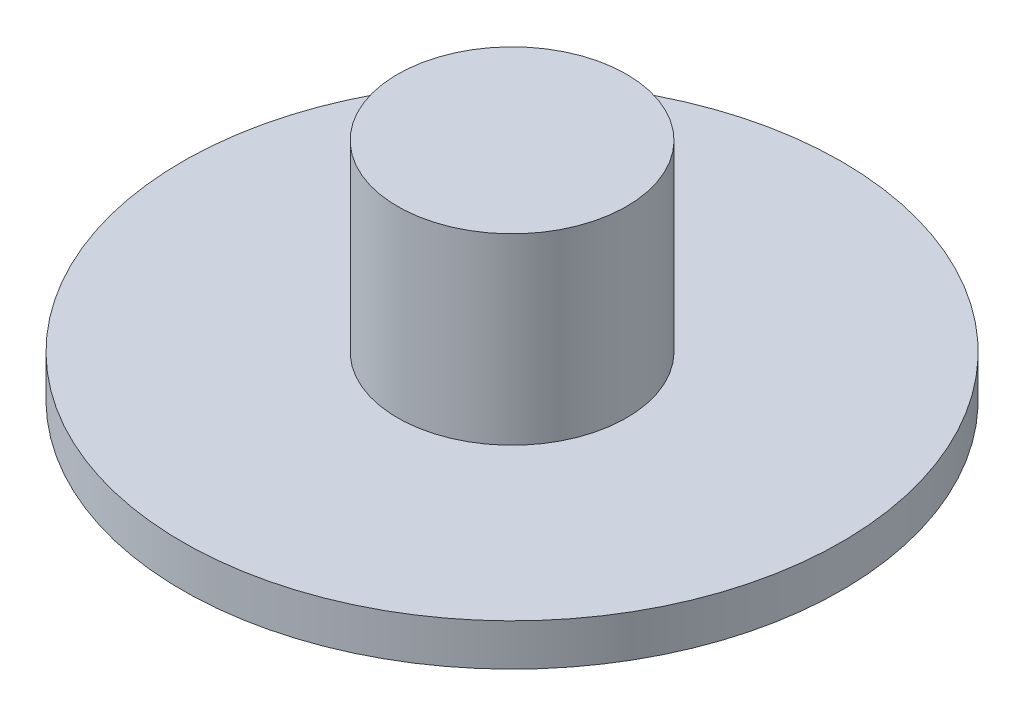
from build123d import *


with BuildPart() as part:
    # Sketch1 → Revolve1 (revolve)
    with BuildSketch(Plane(origin=(0, 0, 0), x_dir=(0, 0, -1), z_dir=(1, 0, 0))):
        Polygon((-20, 0), (0, 0), (0, 13.6525), (-6.95, 13.6525), (-6.95, 2.54), (-20, 2.54), align=None)
    revolve(axis=Axis((0, 0, 0), (0, 1, 0)))


solid = part.part
